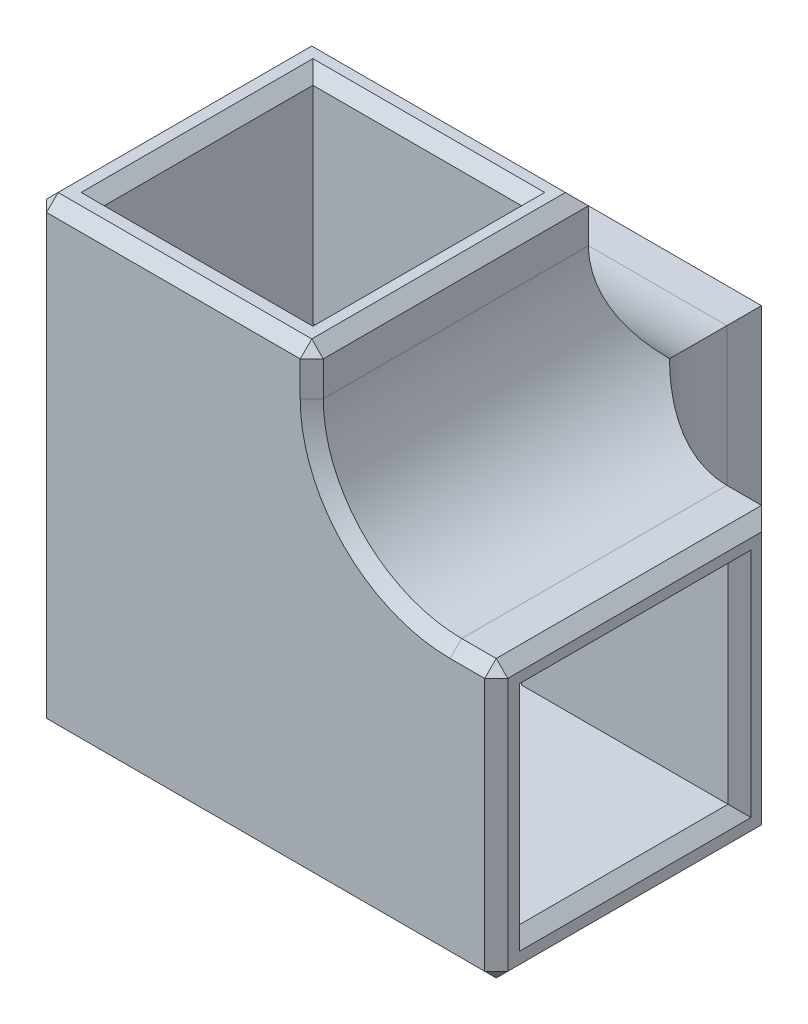
from build123d import *

# Parameters (mm, degrees)
BOSS_EXTRUDE1_DEPTH = 24
SKETCH2_W           = 24
SKETCH2_H           = 24
BOSS_EXTRUDE2_DEPTH = 16
FILLET1_R           = 12
FILLET2_R           = 12
SKETCH3_W           = 18.1
SKETCH3_H           = 18.1
CUT_EXTRUDE1_DEPTH  = 37
SKETCH4_W           = 18.1
SKETCH4_H           = 18.1
CUT_EXTRUDE2_DEPTH  = 37
SKETCH5_W           = 18.1
SKETCH5_H           = 18.1
CUT_EXTRUDE3_DEPTH  = 37
CHAMFER1_SIZE       = 1


with BuildPart() as part:
    # Sketch1 → Boss-Extrude1 (new body)
    with BuildSketch(Plane(origin=(0, 0, 0), x_dir=(1, 0, 0), z_dir=(0, 1, 0))):
        Polygon((-12, 28), (-12, -12), (28, -12), (28, 12), (12, 12), (12, 28), align=None)
    extrude(amount=BOSS_EXTRUDE1_DEPTH)

    # Sketch2 → Boss-Extrude2 (add)
    with BuildSketch(Plane(origin=(0, 24, 0), x_dir=(1, 0, 0), z_dir=(0, 1, 0))):
        Rectangle(SKETCH2_W, SKETCH2_H)
    extrude(amount=BOSS_EXTRUDE2_DEPTH)

    # Fillet1
    # the kernel refuses this fillet: 12 mm, written as the material it adds along each edge
    with BuildSketch(Plane(origin=(12, 24, 12), x_dir=(1, 0, 0), z_dir=(0, 0, -1))) as fillet1_piece_1:
        with BuildLine():
            CenterArc((FILLET1_R, -FILLET1_R), FILLET1_R, 90, 90)
            Line((0, -FILLET1_R), (0, 0))
            Line((0, 0), (FILLET1_R, 0))
        make_face()
    extrude(amount=24)

    # Fillet2
    # the kernel refuses this fillet: 12 mm, written as the material it adds along each edge
    with BuildSketch(Plane(origin=(12, 0, -12), x_dir=(1, 0, 0), z_dir=(0, 1, 0)), Plane(origin=(12, 24, -12), x_dir=(0, 1, 0), z_dir=(-1, 0, 0))) as fillet2_piece_1:
        with BuildLine():
            CenterArc((FILLET2_R, FILLET2_R), FILLET2_R, 180, 90)
            Line((0, FILLET2_R), (0, 0))
            Line((0, 0), (FILLET2_R, 0))
        make_face()
    extrude(amount=24)
    with BuildSketch(Plane(origin=(42, 24, -12), x_dir=(0, 1, 0), z_dir=(-1, 0, 0))) as fillet2_piece_2a_section:
        with BuildLine():
            CenterArc((FILLET2_R, FILLET2_R), FILLET2_R, 180, 90)
            Line((0, FILLET2_R), (0, 0))
            Line((0, 0), (FILLET2_R, 0))
        make_face()
    fillet2_piece_2a = extrude(amount=54, mode=Mode.PRIVATE)
    fillet2_piece_2a = fillet2_piece_2a - Plane(origin=(24, 36, -15.874937315), x_dir=(1, 0, 0), z_dir=(0, 0, 1)) * Cylinder(12, 156, mode=Mode.PRIVATE)
    fillet2_piece_2a = split(fillet2_piece_2a, bisect_by=Plane(origin=(28, 25.203397989, -15.874937315), z_dir=(-1, 0, 0)), keep=Keep.TOP, mode=Mode.PRIVATE)
    fillet2_piece_2a = split(fillet2_piece_2a, bisect_by=Plane(origin=(12, 25.203397989, -15.874937315), z_dir=(1, 0, 0)), keep=Keep.TOP, mode=Mode.PRIVATE)
    with BuildSketch(Plane(origin=(12, 0, -12), x_dir=(1, 0, 0), z_dir=(0, 1, 0))) as fillet2_piece_2b_section:
        with BuildLine():
            CenterArc((FILLET2_R, FILLET2_R), FILLET2_R, 180, 90)
            Line((0, FILLET2_R), (0, 0))
            Line((0, 0), (FILLET2_R, 0))
        make_face()
    fillet2_piece_2b = extrude(amount=54, mode=Mode.PRIVATE)
    fillet2_piece_2b = fillet2_piece_2b - Plane(origin=(24, 36, -15.874937326), x_dir=(1, 0, 0), z_dir=(0, 0, 1)) * Cylinder(12, 156, mode=Mode.PRIVATE)
    fillet2_piece_2b = split(fillet2_piece_2b, bisect_by=Plane(origin=(13.203398, 24, -15.874937326), z_dir=(0, 1, 0)), keep=Keep.TOP, mode=Mode.PRIVATE)
    fillet2_piece_2b = split(fillet2_piece_2b, bisect_by=Plane(origin=(13.203398, 40, -15.874937326), z_dir=(0, -1, 0)), keep=Keep.TOP, mode=Mode.PRIVATE)
    fillet2_piece_2 = fillet2_piece_2a & fillet2_piece_2b
    add(fillet2_piece_2)

    # Sketch3 → Cut-Extrude1 (cut)
    with BuildSketch(Plane(origin=(28, 0, 0), x_dir=(0, 0, -1), z_dir=(1, 0, 0))):
        with Locations((0.05, 12.05)):
            Rectangle(SKETCH3_W, SKETCH3_H)
    extrude(amount=-CUT_EXTRUDE1_DEPTH, mode=Mode.SUBTRACT)

    # Sketch4 → Cut-Extrude2 (cut)
    with BuildSketch(Plane(origin=(0, 40, 0), x_dir=(1, 0, 0), z_dir=(0, 1, 0))):
        with Locations((0.05, 0.05)):
            Rectangle(SKETCH4_W, SKETCH4_H)
    extrude(amount=-CUT_EXTRUDE2_DEPTH, mode=Mode.SUBTRACT)

    # Sketch5 → Cut-Extrude3 (cut)
    with BuildSketch(Plane(origin=(0, 0, -28), x_dir=(-1, 0, 0), z_dir=(0, 0, -1))):
        with Locations((-0.05, 12.05)):
            Rectangle(SKETCH5_W, SKETCH5_H)
    extrude(amount=-CUT_EXTRUDE3_DEPTH, mode=Mode.SUBTRACT)

    # Chamfer1
    chamfer1_edges = [part.edges().sort_by_distance(p)[0] for p in [
        (12, 12, -28),
        (28, 12, -12),
        (28, 12, 12),
        (-12, 20, 12),
        (-12, 12, -28),
        (28, 24, 0),
        (-12, 38, -12),
        (12, 38, 12),
        (-12, 40, 0),
        (0, 40, 12),
        (12, 40, 0),
        (0, 40, -12),
        (26, 24, 12),
        (15.514718626, 27.514718626, 12),
        (0, 24, -28),
        (12, 0, -26),
        (15.514718626, 0, -15.514718626),
        (-12, 27.514718626, -15.514718626),
        (28, 12.05, -9.1),
        (28, 21.1, -0.05),
        (28, 12.05, 9),
        (28, 3, -0.05),
        (26, 0, -12),
        (28, 0, 0),
        (-12, 24, -26),
        (8, 0, 12),
        (9.1, 40, -0.05),
        (0.05, 40, -9.1),
        (-9, 40, -0.05),
        (0.05, 40, 9),
        (-12, 0, -8),
        (0, 0, -28),
        (-9, 12.05, -28),
        (0.05, 21.1, -28),
        (9.1, 12.05, -28),
        (0.05, 3, -28),
    ]]
    chamfer(chamfer1_edges, length=CHAMFER1_SIZE)


solid = part.part
